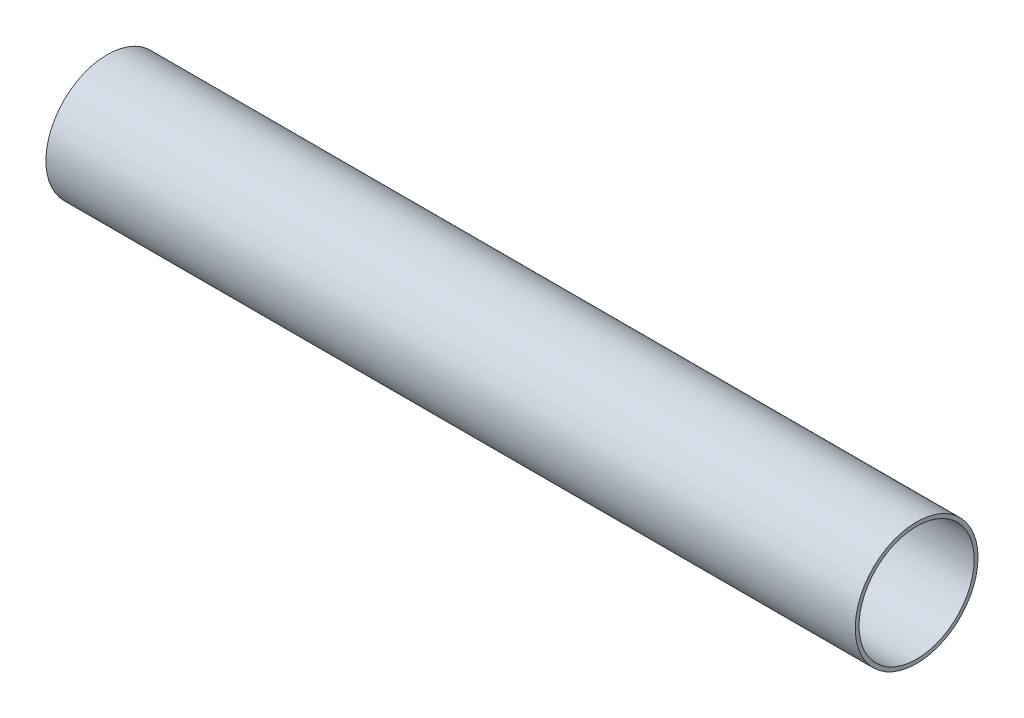
from build123d import *

# Parameters (mm, degrees)
SKETCH1_R           = 25.4
SKETCH1_R_2         = 23.8125
EXTRUDE_THIN1_DEPTH = 167.4495


with BuildPart() as part:
    # Sketch1 → Extrude-Thin1 (new, symmetric)
    with BuildSketch(Plane(origin=(0, 0, 0), x_dir=(0, 0, -1), z_dir=(1, 0, 0))):
        Circle(SKETCH1_R)
        Circle(SKETCH1_R_2, mode=Mode.SUBTRACT)
    extrude(amount=EXTRUDE_THIN1_DEPTH, both=True)


solid = part.part
